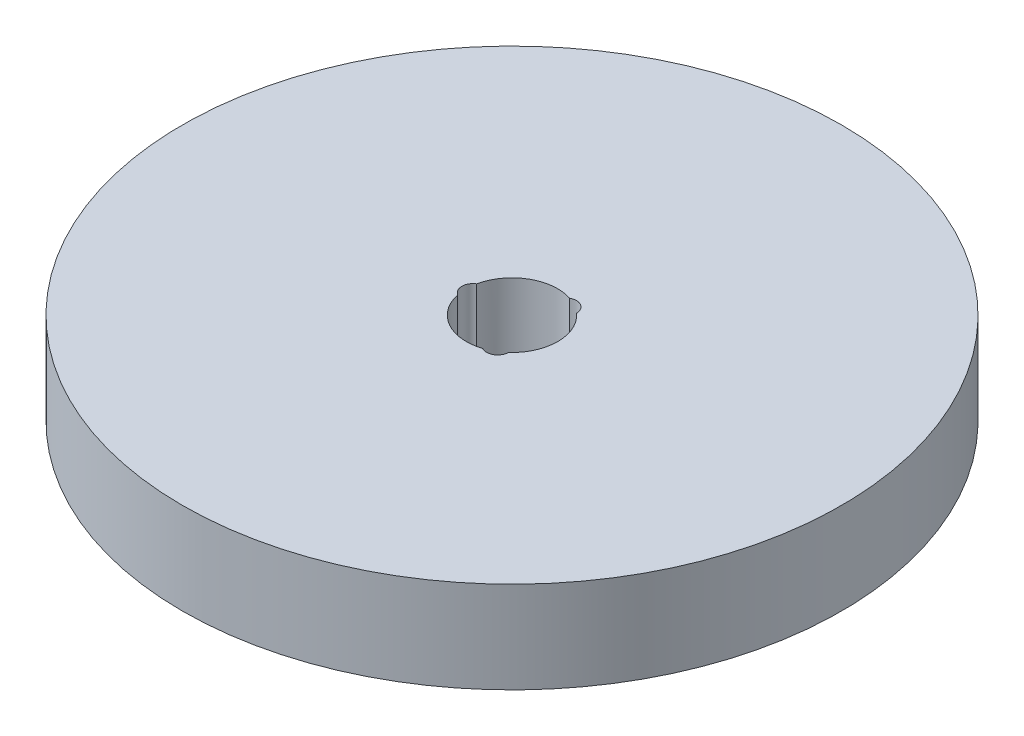
from build123d import *

# Parameters (mm, degrees)
SKETCH1_R           = 90
BOSS_EXTRUDE1_DEPTH = 25
SKETCH2_R           = 12.5
CUT_EXTRUDE1_DEPTH  = 130.711217711
SKETCH3_R           = 3.036116181
CUT_EXTRUDE2_DEPTH  = 23.633763594
CIRPATTERN1_COUNT   = 3


with BuildPart() as part:
    # Sketch1 → Boss-Extrude1 (new body)
    with BuildSketch(Plane(origin=(0, 0, 0), x_dir=(1, 0, 0), z_dir=(0, 1, 0))):
        Circle(SKETCH1_R)
    extrude(amount=BOSS_EXTRUDE1_DEPTH)

    # Sketch2 → Cut-Extrude1 (cut, through all)
    with BuildSketch(Plane(origin=(0, 0, 0), x_dir=(1, 0, 0), z_dir=(0, 1, 0))):
        Circle(SKETCH2_R)
    extrude(amount=CUT_EXTRUDE1_DEPTH, mode=Mode.SUBTRACT)

    # Sketch3 → Cut-Extrude2 (cut)
    with BuildSketch(Plane(origin=(0, 25, 0), x_dir=(1, 0, 0), z_dir=(0, 1, 0))):
        with Locations((-10.651281323, 0)):
            Circle(SKETCH3_R)
    cut_extrude2 = extrude(amount=-CUT_EXTRUDE2_DEPTH, mode=Mode.SUBTRACT)

    # CirPattern1: Cut-Extrude2 ×3 about axis
    cirpattern1_axis = Axis((0, 0, 0), (0, 1, 0))
    for i in range(1, CIRPATTERN1_COUNT):
        add(cut_extrude2.rotate(cirpattern1_axis, i * 360 / CIRPATTERN1_COUNT), mode=Mode.SUBTRACT)


solid = part.part
